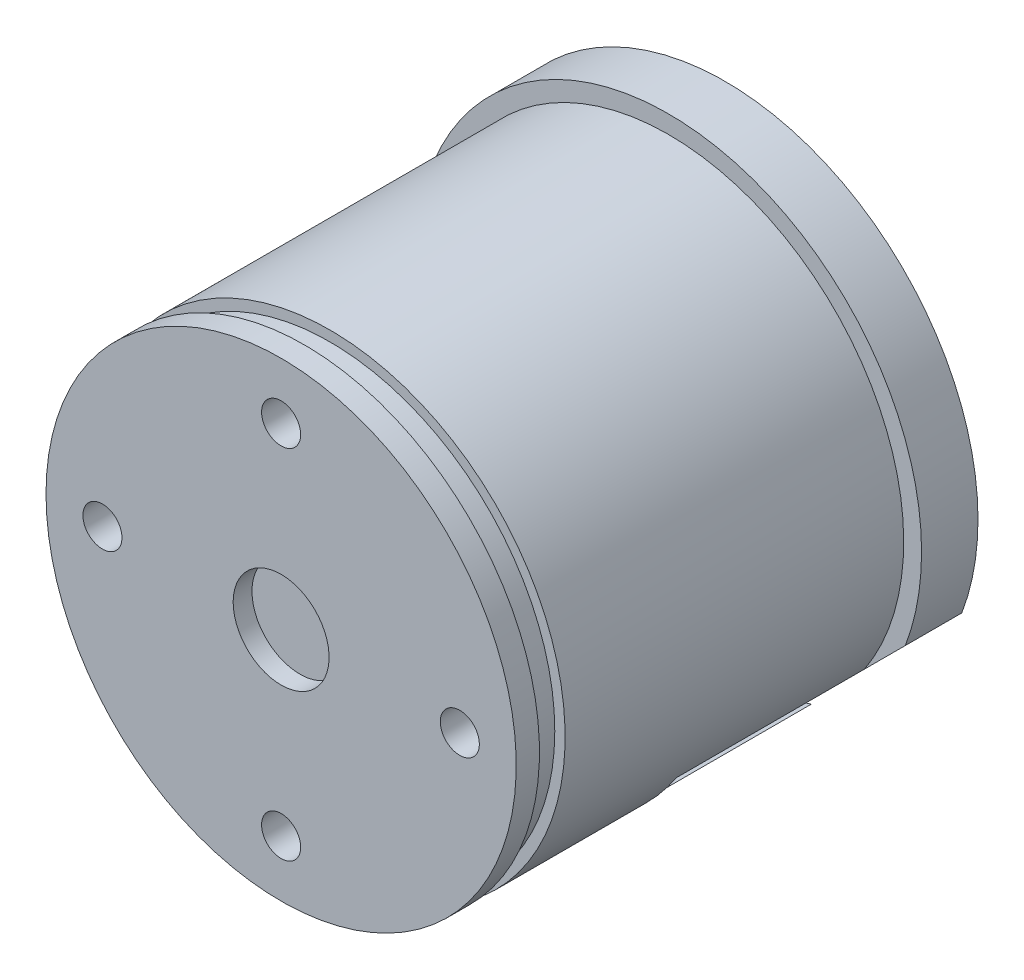
from build123d import *

# Parameters (mm, degrees)
SKETCH11_R              = 1.038643292
CUT_EXTRUDE1_DEPTH      = 29.038634061
CIRPATTERN1_COUNT       = 4
CUT_EXTRUDE2_DEPTH      = 10
CUT_EXTRUDE2_DEPTH_BACK = 29.038634061
CUT_EXTRUDE3_DEPTH      = 29.038634061


with BuildPart() as part:
    # Sketch10 → Revolve1 (revolve)
    with BuildSketch(Plane(origin=(0, 0, 0), x_dir=(1, 0, 0), z_dir=(0, 1, 0))):
        Polygon((-13.45, 3), (0, 3), (0, -19.6), (-2.55, -19.6), (-2.55, -20.6), (-12.5, -20.6), (-12.5, -19.365), (-11.95, -19.365), (-11.95, -18), (-12.5, -18), (-12.5, 0), (-13.45, 0), align=None)
    revolve(axis=Axis((0, 0, -38.468953364), (0, 0, 1)))

    # Sketch11 → Cut-Extrude1 (cut, symmetric)
    with BuildSketch(Plane.XY):
        with Locations((9.5, 0)):
            Circle(SKETCH11_R)
    cut_extrude1 = extrude(amount=CUT_EXTRUDE1_DEPTH, both=True, mode=Mode.SUBTRACT)

    # CirPattern1: Cut-Extrude1 ×4 about axis
    cirpattern1_axis = Axis((0, 0, 21.88), (0, 0, -1))
    for i in range(1, CIRPATTERN1_COUNT):
        add(cut_extrude1.rotate(cirpattern1_axis, i * 360 / CIRPATTERN1_COUNT), mode=Mode.SUBTRACT)

    # Sketch14 → Cut-Extrude2 (cut, two sides: drawn at the far end of the back side and taken through both)
    with BuildSketch(Plane.XY.offset(-CUT_EXTRUDE2_DEPTH_BACK)):
        with BuildLine():
            Line((2.488712619, -7.568632823), (-0.234923155, -0.085505036))
            Line((-0.234923155, -0.085505036), (0.234923155, 0.085505036))
            Line((0.234923155, 0.085505036), (2.958558929, -7.397622752))
            ThreePointArc((2.958558929, -7.397622752), (5.463462014, -9.5943638), (8.66205807, -8.66205807))
            Line((8.66205807, -8.66205807), (17.500892834, 0.176776695))
            Line((17.500892834, 0.176776695), (17.854446225, -0.176776695))
            Line((17.854446225, -0.176776695), (9.01561146, -9.01561146))
            ThreePointArc((9.01561146, -9.01561146), (5.355242207, -10.082511803), (2.488712619, -7.568632823))
        make_face()
    extrude(amount=CUT_EXTRUDE2_DEPTH + CUT_EXTRUDE2_DEPTH_BACK, mode=Mode.SUBTRACT)

    # Sketch15 → Cut-Extrude3 (cut, through all)
    with BuildSketch(Plane.XY):
        Polygon((13.841422119, -3.48269402), (4.052993985, -13.271122155), (6.246974385, -15.465102555), (16.035402519, -5.67667442), align=None)
    extrude(amount=-CUT_EXTRUDE3_DEPTH, mode=Mode.SUBTRACT)


solid = part.part
